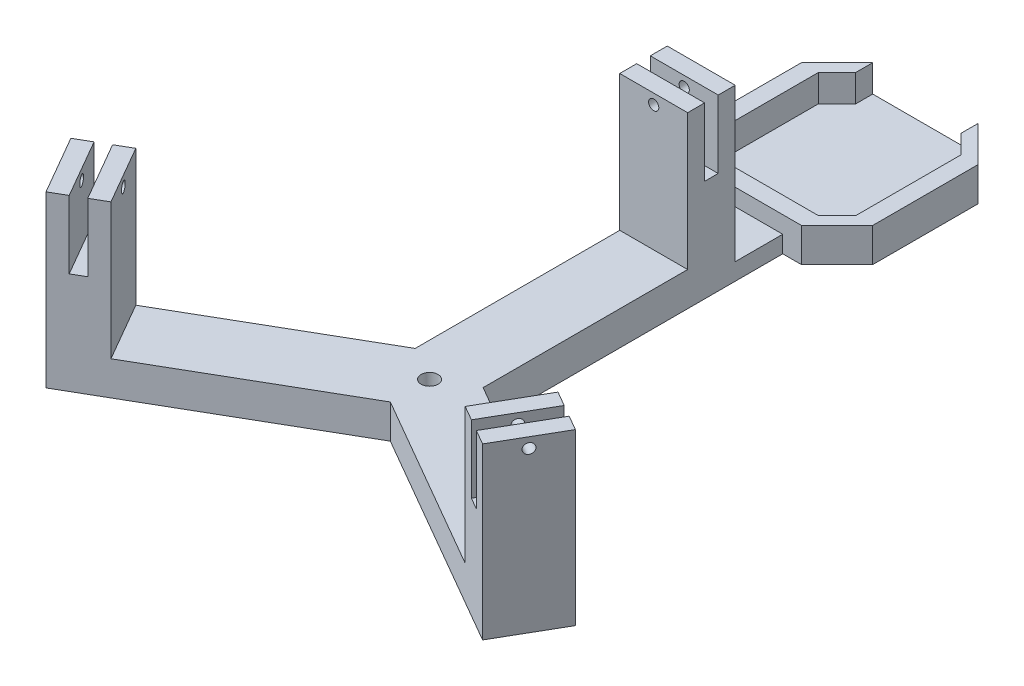
from build123d import *

# Parameters (mm, degrees)
BOSS_EXTRUDE1_DEPTH = 10
SKETCH2_W           = 20
SKETCH2_H           = 14
BOSS_EXTRUDE2_DEPTH = 20
SKETCH3_W           = 20
SKETCH3_H           = 5
BOSS_EXTRUDE3_DEPTH = 20
SKETCH4_R           = 1.5
CUT_EXTRUDE1_DEPTH  = 84.402637848
CIRPATTERN1_COUNT   = 3
SKETCH5_R           = 2.5
CUT_EXTRUDE2_DEPTH  = 117.266161556
SKETCH8_W           = 20
SKETCH8_H           = 14
BOSS_EXTRUDE7_DEPTH = 5
BOSS_EXTRUDE8_DEPTH = 10
CUT_EXTRUDE3_DEPTH  = 8


with BuildPart() as part:
    # Sketch1 → Boss-Extrude1 (new body)
    with BuildSketch(Plane(origin=(0, 0, 0), x_dir=(1, 0, 0), z_dir=(0, 1, 0))):
        Polygon((0, 0), (-10, 5.773502692), (-10, 80), (10, 80), (10, 5.773502692), align=None)
    boss_extrude1 = extrude(amount=BOSS_EXTRUDE1_DEPTH)

    # Sketch2 → Boss-Extrude2 (add)
    with BuildSketch(Plane(origin=(0, 10, 0), x_dir=(1, 0, 0), z_dir=(0, 1, 0))):
        with Locations((0, 73)):
            Rectangle(SKETCH2_W, SKETCH2_H)
    boss_extrude2 = extrude(amount=BOSS_EXTRUDE2_DEPTH)

    # Sketch3 → Boss-Extrude3 (add)
    with BuildSketch(Plane(origin=(0, 30, 0), x_dir=(1, 0, 0), z_dir=(0, 1, 0))):
        with Locations((0, 77.5)):
            Rectangle(SKETCH3_W, SKETCH3_H)
        with Locations((0, 68.5)):
            Rectangle(SKETCH3_W, SKETCH3_H)
    boss_extrude3 = extrude(amount=BOSS_EXTRUDE3_DEPTH)

    # Sketch4 → Cut-Extrude1 (cut, symmetric)
    with BuildSketch(Plane.XY.offset(-66)):
        with Locations((0, 47)):
            Circle(SKETCH4_R)
    cut_extrude1 = extrude(amount=CUT_EXTRUDE1_DEPTH, both=True, mode=Mode.SUBTRACT)

    # CirPattern1: Boss-Extrude1, Boss-Extrude2, Boss-Extrude3, Cut-Extrude1 ×3 about axis
    cirpattern1_axis = Axis((0, 10, 0), (0, -1, 0))
    add([boss_extrude1.rotate(cirpattern1_axis, i * 360 / CIRPATTERN1_COUNT) for i in range(1, CIRPATTERN1_COUNT)])
    add([boss_extrude2.rotate(cirpattern1_axis, i * 360 / CIRPATTERN1_COUNT) for i in range(1, CIRPATTERN1_COUNT)])
    add([boss_extrude3.rotate(cirpattern1_axis, i * 360 / CIRPATTERN1_COUNT) for i in range(1, CIRPATTERN1_COUNT)])
    add([cut_extrude1.rotate(cirpattern1_axis, i * 360 / CIRPATTERN1_COUNT) for i in range(1, CIRPATTERN1_COUNT)], mode=Mode.SUBTRACT)

    # Sketch5 → Cut-Extrude2 (cut, through all)
    with BuildSketch(Plane(origin=(0, 10, 0), x_dir=(1, 0, 0), z_dir=(0, 1, 0))):
        Circle(SKETCH5_R)
    extrude(amount=-CUT_EXTRUDE2_DEPTH, mode=Mode.SUBTRACT)

    # Sketch8 → Boss-Extrude7 (add)
    with BuildSketch(Plane(origin=(0, 0, 0), x_dir=(1, 0, 0), z_dir=(0, 1, 0))):
        with Locations((0, 87)):
            Rectangle(SKETCH8_W, SKETCH8_H)
    extrude(amount=BOSS_EXTRUDE7_DEPTH)

    # Sketch11 → Boss-Extrude8 (add)
    with BuildSketch(Plane(origin=(0, 0, 0), x_dir=(1, 0, 0), z_dir=(0, 1, 0))):
        Polygon((-15.5, 94), (15.5, 94), (26, 104.5), (26, 135.5), (15.5, 146), (-15.5, 146), (-26, 135.5), (-26, 104.5), align=None)
    extrude(amount=BOSS_EXTRUDE8_DEPTH)

    # Sketch12 → Cut-Extrude3 (cut)
    with BuildSketch(Plane(origin=(0, 10, 0), x_dir=(1, 0, 0), z_dir=(0, 1, 0))):
        Polygon((-21, 104.5), (-21, 135.5), (-15.5, 141), (-15.5, 146), (15.5, 146), (15.5, 141), (21, 135.5), (21, 104.5), (15.5, 99), (-15.5, 99), align=None)
    extrude(amount=-CUT_EXTRUDE3_DEPTH, mode=Mode.SUBTRACT)


solid = part.part
